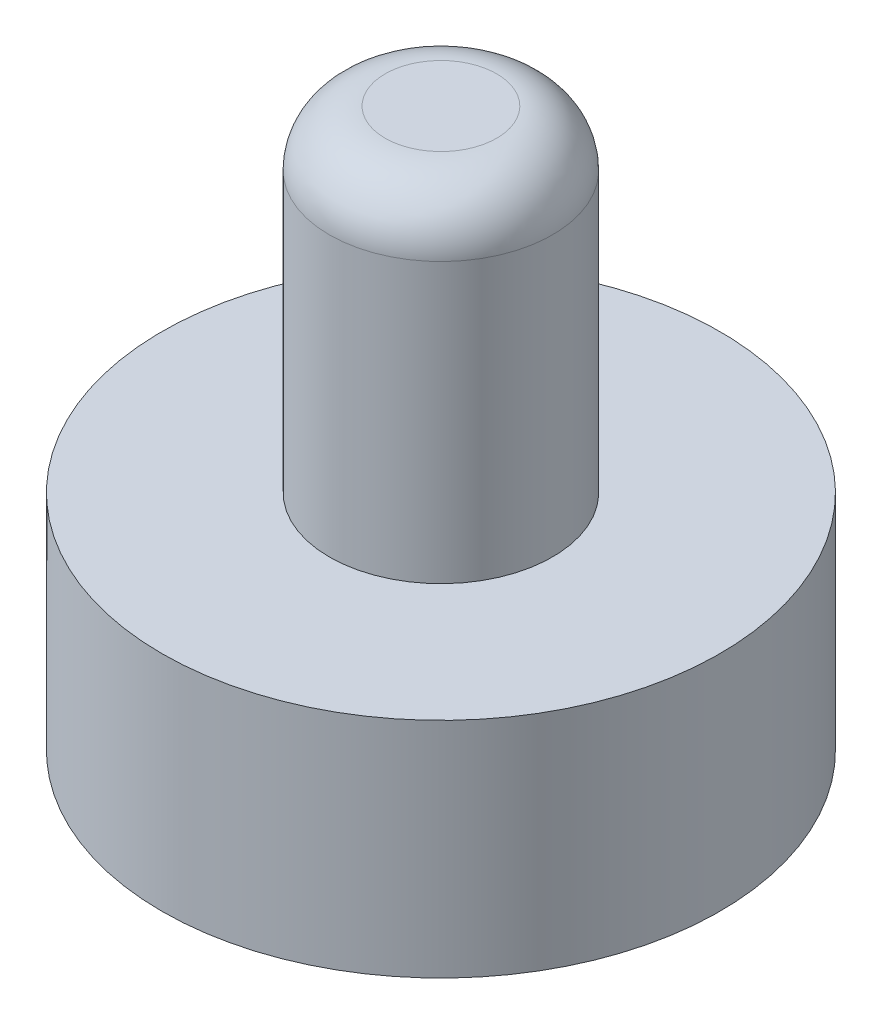
from build123d import *

# Parameters (mm, degrees)
SKETCH_1_R      = 2.5
EXTRUDE_1_DEPTH = 2
SKETCH_2_R      = 1
EXTRUDE_2_DEPTH = 3
FILLET_1_R      = 0.5


with BuildPart() as part:
    # 草图1 → 凸台-拉伸1 (new body)
    with BuildSketch(Plane(origin=(0, 0, 0), x_dir=(1, 0, 0), z_dir=(0, 1, 0))):
        Circle(SKETCH_1_R)
    extrude(amount=EXTRUDE_1_DEPTH)

    # 草图2 → 凸台-拉伸2 (add)
    with BuildSketch(Plane(origin=(0, 2, 0), x_dir=(1, 0, 0), z_dir=(0, 1, 0))):
        Circle(SKETCH_2_R)
    extrude(amount=EXTRUDE_2_DEPTH)

    # 圆角1
    fillet_1_edges = [part.edges().sort_by_distance(p)[0] for p in [
        (-1, 5, 0),
    ]]
    fillet(fillet_1_edges, radius=FILLET_1_R)


solid = part.part
